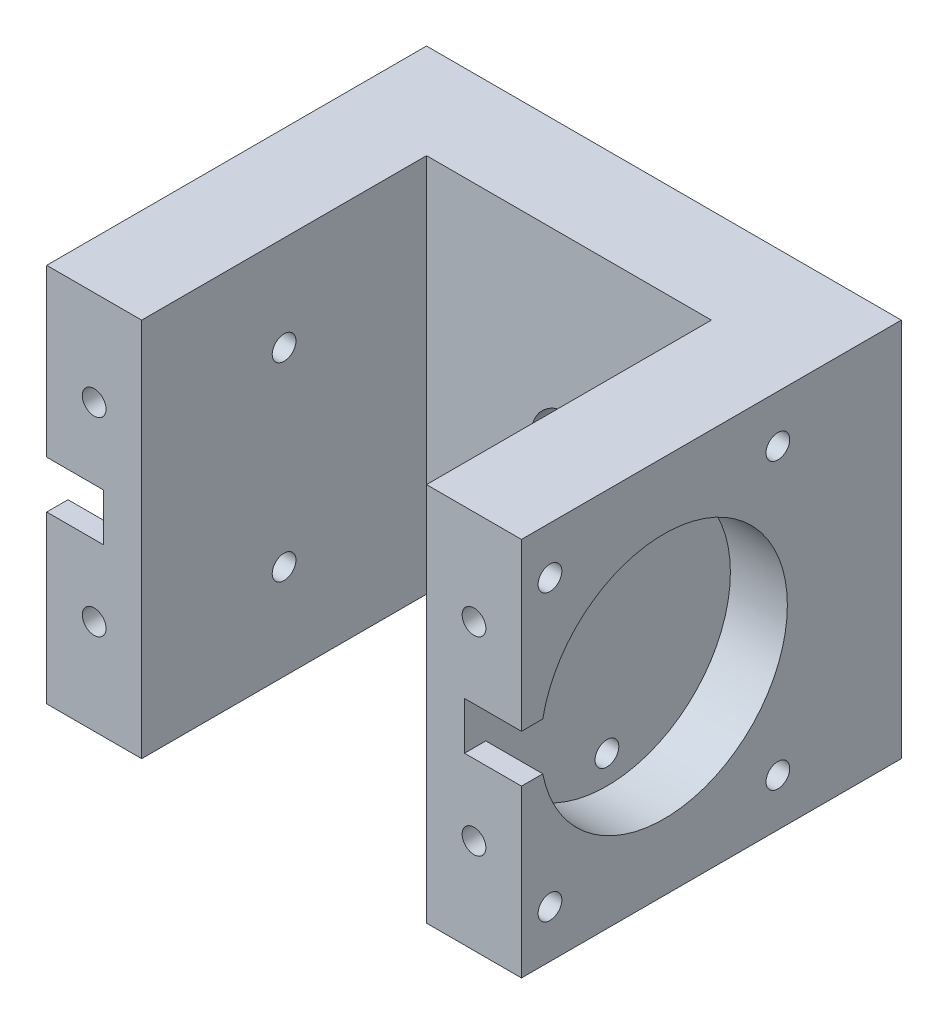
from build123d import *

# Parameters (mm, degrees)
SKETCH1_W                 = 50
SKETCH1_H                 = 40
BOSS_EXTRUDE1_DEPTH       = 40
CUT_EXTRUDE1_REACH        = 53.235
SKETCH2_W                 = 30
SKETCH2_H                 = 30
SKETCH3_R                 = 13
CUT_EXTRUDE2_DEPTH        = 6
CUT_EXTRUDE3_START        = -6
SKETCH4_R                 = 13
CUT_EXTRUDE3_DEPTH        = 6
M3X0_5_TAPPED_HOLE1_D     = 2.5
M3X0_5_TAPPED_HOLE1_DEPTH = 6.5
M3X0_5_TAPPED_HOLE1_TIP   = 0.751075774
M3X0_5_TAPPED_HOLE2_D     = 2.5
M3X0_5_TAPPED_HOLE2_DEPTH = 6.5
M3X0_5_TAPPED_HOLE2_TIP   = 0.751075774
M3X0_5_TAPPED_HOLE3_D     = 2.5
M3X0_5_TAPPED_HOLE3_DEPTH = 4
M3X0_5_TAPPED_HOLE3_TIP   = 0.751075774
SKETCH13_R                = 4
CUT_EXTRUDE4_DEPTH        = 8
SKETCH15_W                = 4
SKETCH15_H                = 5
CUT_EXTRUDE5_DEPTH        = 6
SKETCH16_W                = 4
SKETCH16_H                = 5
CUT_EXTRUDE6_DEPTH        = 6
M3X0_5_TAPPED_HOLE4_D     = 2.5
M3X0_5_TAPPED_HOLE4_DEPTH = 6.5
M3X0_5_TAPPED_HOLE4_TIP   = 0.751075774
M3X0_5_TAPPED_HOLE5_D     = 2.5
M3X0_5_TAPPED_HOLE5_DEPTH = 6.5
M3X0_5_TAPPED_HOLE5_TIP   = 0.751075774


with BuildPart() as part:
    # Sketch1 → Boss-Extrude1 (new body)
    with BuildSketch(Plane(origin=(0, 0, 0), x_dir=(1, 0, 0), z_dir=(0, 1, 0))):
        Rectangle(SKETCH1_W, SKETCH1_H)
    extrude(amount=BOSS_EXTRUDE1_DEPTH)

    # Sketch2 → Cut-Extrude1 (cut, up to next)
    with BuildSketch(Plane(origin=(0, 40, 0), x_dir=(1, 0, 0), z_dir=(0, 1, 0)), mode=Mode.PRIVATE) as cut_extrude1_sk1:
        with Locations((0, -5)):
            Rectangle(SKETCH2_W, SKETCH2_H)
    cut_extrude1_tool1 = extrude(cut_extrude1_sk1.sketch, amount=-CUT_EXTRUDE1_REACH, mode=Mode.PRIVATE) & part.part
    add(cut_extrude1_tool1.solids().sort_by_distance((0, 40, 5))[0], mode=Mode.SUBTRACT)

    # Sketch3 → Cut-Extrude2 (cut)
    with BuildSketch(Plane.ZY.offset(25)):
        with Locations((5, 20)):
            Circle(SKETCH3_R)
    extrude(amount=-CUT_EXTRUDE2_DEPTH, mode=Mode.SUBTRACT)

    # Sketch4 → Cut-Extrude3 (cut)
    with BuildSketch(Plane(origin=(25, 0, 0), x_dir=(0, 0, -1), z_dir=(1, 0, 0)).offset(CUT_EXTRUDE3_START)):
        with Locations((-5, 20)):
            Circle(SKETCH4_R)
    extrude(amount=CUT_EXTRUDE3_DEPTH, mode=Mode.SUBTRACT)

    # M3x0.5 Tapped Hole1
    with Locations(Plane.ZY.offset(19)):
        with Locations((5, 30), (5, 10)):
            Hole(M3X0_5_TAPPED_HOLE1_D / 2, depth=M3X0_5_TAPPED_HOLE1_DEPTH)
            with Locations((0, 0, -(M3X0_5_TAPPED_HOLE1_DEPTH + M3X0_5_TAPPED_HOLE1_TIP / 2))):  # 118° drill point
                Cone(0, M3X0_5_TAPPED_HOLE1_D / 2, M3X0_5_TAPPED_HOLE1_TIP, mode=Mode.SUBTRACT)

    # M3x0.5 Tapped Hole2
    with Locations(Plane(origin=(19, 0, 0), x_dir=(0, 0, -1), z_dir=(1, 0, 0))):
        with Locations((-5, 30), (-5, 10)):
            Hole(M3X0_5_TAPPED_HOLE2_D / 2, depth=M3X0_5_TAPPED_HOLE2_DEPTH)
            with Locations((0, 0, -(M3X0_5_TAPPED_HOLE2_DEPTH + M3X0_5_TAPPED_HOLE2_TIP / 2))):  # 118° drill point
                Cone(0, M3X0_5_TAPPED_HOLE2_D / 2, M3X0_5_TAPPED_HOLE2_TIP, mode=Mode.SUBTRACT)

    # M3x0.5 Tapped Hole3
    with Locations(Plane.XY.offset(20)):
        with Locations((-20, 30), (-20, 10), (20, 10), (20, 30)):
            Hole(M3X0_5_TAPPED_HOLE3_D / 2, depth=M3X0_5_TAPPED_HOLE3_DEPTH)
            with Locations((0, 0, -(M3X0_5_TAPPED_HOLE3_DEPTH + M3X0_5_TAPPED_HOLE3_TIP / 2))):  # 118° drill point
                Cone(0, M3X0_5_TAPPED_HOLE3_D / 2, M3X0_5_TAPPED_HOLE3_TIP, mode=Mode.SUBTRACT)

    # Sketch13 → Cut-Extrude4 (cut)
    with BuildSketch(Plane.XY.offset(-10)):
        with Locations((0, 20)):
            Circle(SKETCH13_R)
    extrude(amount=-CUT_EXTRUDE4_DEPTH, mode=Mode.SUBTRACT)

    # Sketch15 → Cut-Extrude5 (cut)
    with BuildSketch(Plane(origin=(25, 0, 0), x_dir=(0, 0, -1), z_dir=(1, 0, 0))):
        with Locations((-18, 20)):
            Rectangle(SKETCH15_W, SKETCH15_H)
    extrude(amount=-CUT_EXTRUDE5_DEPTH, mode=Mode.SUBTRACT)

    # Sketch16 → Cut-Extrude6 (cut)
    with BuildSketch(Plane.ZY.offset(25)):
        with Locations((18, 20)):
            Rectangle(SKETCH16_W, SKETCH16_H)
    extrude(amount=-CUT_EXTRUDE6_DEPTH, mode=Mode.SUBTRACT)

    # M3x0.5 Tapped Hole4
    with Locations(Plane.ZY.offset(25)):
        with Locations((-7, 35), (-7, 5), (17, 5), (17, 35)):
            Hole(M3X0_5_TAPPED_HOLE4_D / 2, depth=M3X0_5_TAPPED_HOLE4_DEPTH)
            with Locations((0, 0, -(M3X0_5_TAPPED_HOLE4_DEPTH + M3X0_5_TAPPED_HOLE4_TIP / 2))):  # 118° drill point
                Cone(0, M3X0_5_TAPPED_HOLE4_D / 2, M3X0_5_TAPPED_HOLE4_TIP, mode=Mode.SUBTRACT)

    # M3x0.5 Tapped Hole5
    with Locations(Plane(origin=(25, 0, 0), x_dir=(0, 0, -1), z_dir=(1, 0, 0))):
        with Locations((-17, 35), (7, 35), (7, 5), (-17, 5)):
            Hole(M3X0_5_TAPPED_HOLE5_D / 2, depth=M3X0_5_TAPPED_HOLE5_DEPTH)
            with Locations((0, 0, -(M3X0_5_TAPPED_HOLE5_DEPTH + M3X0_5_TAPPED_HOLE5_TIP / 2))):  # 118° drill point
                Cone(0, M3X0_5_TAPPED_HOLE5_D / 2, M3X0_5_TAPPED_HOLE5_TIP, mode=Mode.SUBTRACT)


solid = part.part
